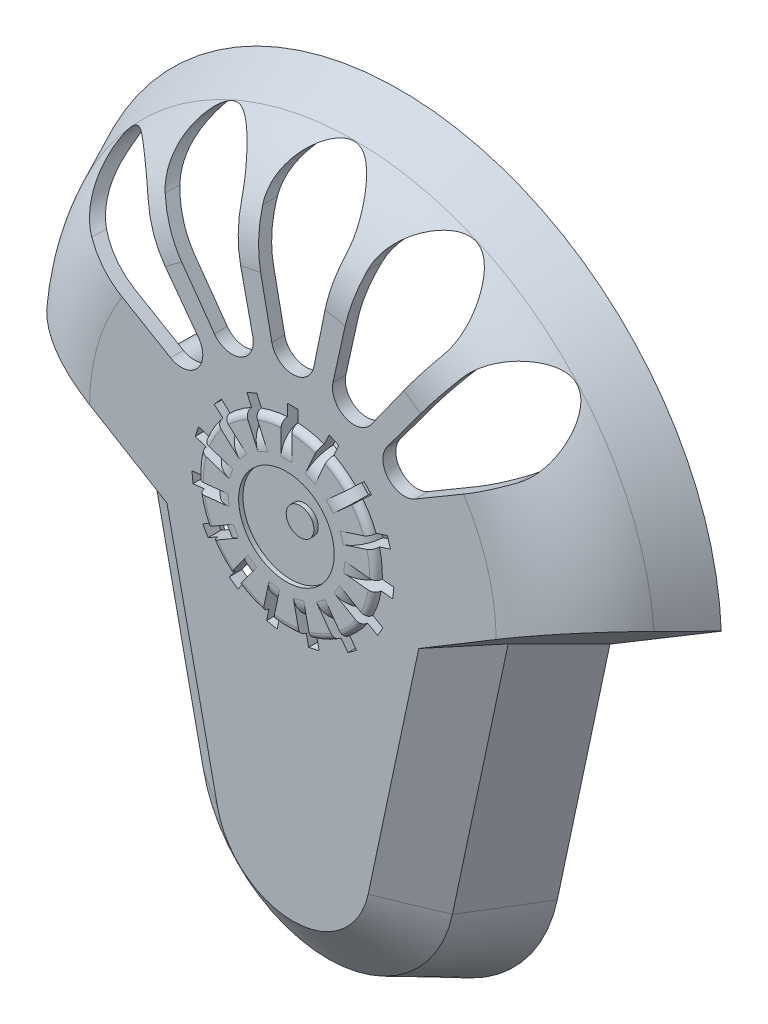
from build123d import *
from OCP.BRepFilletAPI import BRepFilletAPI_MakeChamfer

# Parameters (mm, degrees)
BOSS_EXTRUDE1_DEPTH           = 12.7
BOSS_EXTRUDE1_DRAFT           = 25
CHAMFER1_SIZE                 = 4.5974
CHAMFER1_SIZE2                = 4.007661149
FILLET1_R                     = 12.7
SHELL1_T                      = -1.524
CUT_EXTRUDE2_DEPTH            = 62.981023079
SKETCH3_R                     = 10.6045
BOSS_EXTRUDE2_DEPTH           = 0.762
SKETCH4_W                     = 1.27
SKETCH4_H                     = 2.54
CUT_EXTRUDE3_DEPTH            = 63.141633919
FILLET2_R                     = 2.54
FILLET4_R                     = 0.762
CIRPATTERN1_START             = 0.814632671
CIRPATTERN1_DEPTH             = 1.27
CIRPATTERN1_START_2           = -2.084632671
CIRPATTERN1_2_DEPTH           = 1.27
CIRPATTERN1_START_3           = -3.283610683
CIRPATTERN1_3_DEPTH           = 1.27
CIRPATTERN1_START_4           = -4.024619847
CIRPATTERN1_4_DEPTH           = 1.27
CIRPATTERN1_START_5           = 2.909532945
CIRPATTERN1_5_DEPTH           = 1.27
CIRPATTERN1_START_6           = 2.451564096
CIRPATTERN1_6_DEPTH           = 1.27
CIRPATTERN1_START_7           = 1.459900274
CIRPATTERN1_7_DEPTH           = 1.27
CIRPATTERN1_START_8           = 0.106009163
CIRPATTERN1_8_DEPTH           = 1.27
CIRPATTERN1_START_9           = -1.376009163
CIRPATTERN1_9_DEPTH           = 1.27
CIRPATTERN1_START_10          = -2.729900274
CIRPATTERN1_10_DEPTH          = 1.27
CIRPATTERN1_START_11          = -3.721564096
CIRPATTERN1_11_DEPTH          = 1.27
CIRPATTERN1_START_12          = -4.179532945
CIRPATTERN1_12_DEPTH          = 1.27
CIRPATTERN1_START_13          = 2.754619847
CIRPATTERN1_13_DEPTH          = 1.27
CIRPATTERN1_START_14          = 2.013610683
CIRPATTERN1_14_DEPTH          = 1.27
SKETCH5_R                     = 5.663799449
SKETCH5_R_2                   = 1.641486717
CUT_EXTRUDE4_DEPTH            = 0.508
SKETCH6_R                     = 2.2225
BOSS_EXTRUDE4_DEPTH           = 9.525
BOSS_EXTRUDE4_DRAFT           = -1
BOSS_EXTRUDE4_PROFILE_2_DEPTH = 9.525
BOSS_EXTRUDE4_PROFILE_2_DRAFT = -1
BOSS_EXTRUDE4_PROFILE_3_DEPTH = 9.525
BOSS_EXTRUDE4_PROFILE_3_DRAFT = -1
SKETCH9_R                     = 1.27
CUT_EXTRUDE5_DEPTH            = 2.54
CUT_EXTRUDE5_DRAFT            = -1
CUT_EXTRUDE5_PROFILE_2_DEPTH  = 2.54
CUT_EXTRUDE5_PROFILE_2_DRAFT  = -1
CUT_EXTRUDE5_PROFILE_3_DEPTH  = 2.54
CUT_EXTRUDE5_PROFILE_3_DRAFT  = -1
SKETCH10_R                    = 7.62
SKETCH10_R_2                  = 6.35
BOSS_EXTRUDE5_DEPTH           = 3.302


# Read off the part's stored shape, not the designer's step: CirPattern1
# Some blends are built 0.0001 mm under size
with BuildPart() as part:
    # Sketch1 → Boss-Extrude1 (with draft: the straight prism first)
    with BuildSketch(Plane.XY):
        with BuildLine():
            Line((-24.874524999, -2.785942777), (-18.633711794, -32.146660487))
            ThreePointArc((-18.633711794, -32.146660487), (0, -47.235942777), (18.633711794, -32.146660487))
            Line((18.633711794, -32.146660487), (24.874524999, -2.785942777))
            Line((24.874524999, -2.785942777), (38.067347186, 5.14110453))
            ThreePointArc((38.067347186, 5.14110453), (0, 41.664057223), (-38.067347186, 5.14110453))
            Line((-38.067347186, 5.14110453), (-24.874524999, -2.785942777))
        make_face()
    extrude(amount=BOSS_EXTRUDE1_DEPTH)
    # Boss-Extrude1: the draft: its side faces are tilted about the plane it starts from
    boss_extrude1_sides = [part.faces().sort_by_distance(p)[0] for p in [
        (-31.470936092, 1.177580877, 6.35),
        (-21.754118396, -17.466301632, 6.35),
        (0, -47.235942777, 6.35),
        (21.754118396, -17.466301632, 6.35),
        (31.470936092, 1.177580877, 6.35),
        (0, 41.664057223, 6.35),
    ]]
    draft(boss_extrude1_sides, Plane.XY, BOSS_EXTRUDE1_DRAFT)

    # Chamfer1: one chamfer whose edges measure the first distance from different faces: ONE call of the kernel's chamfer builder (chamfer() names one face for all edges)
    chamfer1_edges_1 = [part.edges().sort_by_distance(p)[0] for p in [
        (0, -41.313835518, 12.7),
    ]]
    chamfer1_side_1 = [part.faces().sort_by_distance(p)[0] for p in [
        (0, -44.274889147, 6.35),
    ]]
    chamfer1_edges_2 = [part.edges().sort_by_distance(p)[0] for p in [
        (16.229110266, -14.975658562, 12.7),
    ]]
    chamfer1_side_2 = [part.faces().sort_by_distance(p)[0] for p in [
        (18.953741494, -16.203907232, 6.437055985),
    ]]
    chamfer1_edges_3 = [part.edges().sort_by_distance(p)[0] for p in [
        (-16.229110266, -14.975658562, 12.7),
    ]]
    chamfer1_side_3 = [part.faces().sort_by_distance(p)[0] for p in [
        (-18.953741494, -16.203907232, 6.437055985),
    ]]
    chamfer1 = BRepFilletAPI_MakeChamfer(part.part.solid().wrapped)
    for e in chamfer1_edges_1:
        chamfer1.Add(CHAMFER1_SIZE, CHAMFER1_SIZE2, e.wrapped, chamfer1_side_1[0].wrapped)  # the first distance lies on this face
    for e in chamfer1_edges_2:
        chamfer1.Add(CHAMFER1_SIZE, CHAMFER1_SIZE2, e.wrapped, chamfer1_side_2[0].wrapped)  # the first distance lies on this face
    for e in chamfer1_edges_3:
        chamfer1.Add(CHAMFER1_SIZE, CHAMFER1_SIZE2, e.wrapped, chamfer1_side_3[0].wrapped)  # the first distance lies on this face
    add(Compound.cast(chamfer1.Shape()), mode=Mode.REPLACE)

    # Fillet1
    fillet1_edges = [part.edges().sort_by_distance(p)[0] for p in [
        (0, 35.741949965, 12.7),
    ]]
    fillet(fillet1_edges, radius=FILLET1_R)

    # Shell1
    shell1_openings = [part.faces().sort_by_distance(p)[0] for p in [
        (0, 1.750652069, 0),
    ]]
    offset(amount=SHELL1_T, openings=shell1_openings, kind=Kind.INTERSECTION)

    # Sketch2 → Cut-Extrude2 (cut, through all)
    with BuildSketch(Plane.XY.offset(12.7)):
        with BuildLine():
            Line((9.298679051, 18.330576377), (16.531135955, 28.456284605))
            ThreePointArc((16.531135955, 28.456284605), (14.463555028, 36.049733697), (7.437040948, 32.505236569))
            Line((7.437040948, 32.505236569), (4.751631547, 20.355052359))
            ThreePointArc((4.751631547, 20.355052359), (6.19866644, 17.486489998), (9.298679051, 18.330576377))
        make_face()
        with BuildLine():
            Line((2.488681579, 20.836057223), (4.977363157, 33.028057223))
            ThreePointArc((4.977363157, 33.028057223), (0, 39.124057223), (-4.977363157, 33.028057223))
            Line((-4.977363157, 33.028057223), (-2.488681579, 20.836057223))
            ThreePointArc((-2.488681579, 20.836057223), (0, 18.804057223), (2.488681579, 20.836057223))
        make_face()
        with BuildLine():
            Line((14.500850439, 13.271830219), (25.226525165, 19.580419734))
            ThreePointArc((25.226525165, 19.580419734), (26.426229994, 27.358341586), (18.56551311, 26.978223084))
            Line((18.56551311, 26.978223084), (11.170344412, 16.970731894))
            ThreePointArc((11.170344412, 16.970731894), (11.32552714, 13.761607664), (14.500850439, 13.271830219))
        make_face()
    cut_extrude2 = extrude(amount=-CUT_EXTRUDE2_DEPTH, mode=Mode.SUBTRACT)

    # Mirror1: Cut-Extrude2 across plane
    add(cut_extrude2.mirror(Plane(origin=(0, 0, 0), x_dir=(0, 0, 1), z_dir=(1, 0, 0))), mode=Mode.SUBTRACT)

    # Sketch3 → Boss-Extrude2 (add)
    with BuildSketch(Plane.XY.offset(12.7)):
        with Locations(Location((0, 3.564057223, 0), (0, 0, 180))):
            Circle(SKETCH3_R)
    extrude(amount=BOSS_EXTRUDE2_DEPTH)

    # Sketch4 → Cut-Extrude3 (cut, through all)
    with BuildSketch(Plane.XY.offset(13.462)):
        with Locations((0, 14.257457223)):
            Rectangle(SKETCH4_W, SKETCH4_H)
    extrude(amount=-CUT_EXTRUDE3_DEPTH, mode=Mode.SUBTRACT)

    # Fillet2
    # the kernel refuses this fillet: 2.54 mm, written as the material it takes off along each edge
    with BuildSketch(Plane(origin=(-0.635, 12.987457223, 13.462), x_dir=(0, 0, -1), z_dir=(1, 0, 0))) as fillet2_piece_1:
        with BuildLine():
            CenterArc((2.54, -2.52726809), FILLET2_R, 95.739170477, 84.260829523)
            Line((0, -2.52726809), (-0.0508, -2.52726809))
            Line((-0.0508, -2.52726809), (-0.0508, 0))
            Line((-0.0508, 0), (0, 0.0508))
            ThreePointArc((0, 0.0508), (1.143, 0.0508), (2.28092, 0.050545362))
            Line((2.28092, 0.050545362), (2.286, 0))
        make_face()
    extrude(amount=1.27, mode=Mode.SUBTRACT)

    # Fillet4
    fillet4_edges = [part.edges().sort_by_distance(p)[0] for p in [
        (0, -7.040442777, 13.462),
    ]]
    fillet(fillet4_edges, radius=FILLET4_R - 0.0001)  # a hair under: the kernel refuses the full size

    # CirPattern1 outline → CirPattern1 (cut)
    with BuildSketch(Plane(origin=(0, 0, 0), x_dir=(-0.4067366430758008, 0.9135454576426006, 0), z_dir=(0.9135454576426006, 0.4067366430758008, 0)).offset(CIRPATTERN1_START)):
        with BuildLine():
            Line((15.219328287, 10), (15.219328287, 13.462))
            Line((15.219328287, 13.462), (10.152060197, 13.462))
            ThreePointArc((10.152060197, 13.462), (11.855943996, 12.805714416), (12.679328287, 11.176))
            Line((12.679328287, 11.176), (12.797520734, 10))
            Line((12.797520734, 10), (15.219328287, 10))
        make_face()
    extrude(amount=CIRPATTERN1_DEPTH, mode=Mode.SUBTRACT)

    # CirPattern1 2 outline → CirPattern1 2 (cut)
    with BuildSketch(Plane(origin=(0, 0, 0), x_dir=(0.40673664307578905, 0.9135454576426059, 0), z_dir=(0.913545457642606, -0.406736643075789, 0)).offset(CIRPATTERN1_START_2)):
        with BuildLine():
            Line((15.219328287, 10), (15.219328287, 13.462))
            Line((15.219328287, 13.462), (10.152060197, 13.462))
            ThreePointArc((10.152060197, 13.462), (11.855943996, 12.805714416), (12.679328287, 11.176))
            Line((12.679328287, 11.176), (12.797520734, 10))
            Line((12.797520734, 10), (15.219328287, 10))
        make_face()
    extrude(amount=CIRPATTERN1_2_DEPTH, mode=Mode.SUBTRACT)

    # CirPattern1 3 outline → CirPattern1 3 (cut)
    with BuildSketch(Plane(origin=(0, 0, 0), x_dir=(0.743144825477386, 0.6691306063588673, 0), z_dir=(0.6691306063588672, -0.7431448254773863, 0)).offset(CIRPATTERN1_START_3)):
        with BuildLine():
            Line((14.348219771, 10), (14.348219771, 13.462))
            Line((14.348219771, 13.462), (9.280951681, 13.462))
            ThreePointArc((9.280951681, 13.462), (10.98483548, 12.805714416), (11.808219771, 11.176))
            Line((11.808219771, 11.176), (11.926412218, 10))
            Line((11.926412218, 10), (14.348219771, 10))
        make_face()
    extrude(amount=CIRPATTERN1_3_DEPTH, mode=Mode.SUBTRACT)

    # CirPattern1 4 outline → CirPattern1 4 (cut)
    with BuildSketch(Plane(origin=(0, 0, 0), x_dir=(0.9510565162951504, 0.3090169943749572, 0), z_dir=(0.30901699437495717, -0.9510565162951505, 0)).offset(CIRPATTERN1_START_4)):
        with BuildLine():
            Line((13.064754251, 10), (13.064754251, 13.462))
            Line((13.064754251, 13.462), (7.997486161, 13.462))
            ThreePointArc((7.997486161, 13.462), (9.70136996, 12.805714416), (10.524754251, 11.176))
            Line((10.524754251, 11.176), (10.642946698, 10))
            Line((10.642946698, 10), (13.064754251, 10))
        make_face()
    extrude(amount=CIRPATTERN1_4_DEPTH, mode=Mode.SUBTRACT)

    # CirPattern1 5 outline → CirPattern1 5 (cut)
    with BuildSketch(Plane(origin=(0, 0, 0), x_dir=(0.9945218953682743, -0.10452846326764395, 0), z_dir=(0.10452846326764395, 0.9945218953682744, 0)).offset(CIRPATTERN1_START_5)):
        with BuildLine():
            Line((11.590854575, -13.462), (11.590854575, -10))
            Line((11.590854575, -10), (9.169047022, -10))
            Line((9.169047022, -10), (9.050854575, -11.176))
            ThreePointArc((9.050854575, -11.176), (8.227470284, -12.805714416), (6.523586485, -13.462))
            Line((6.523586485, -13.462), (11.590854575, -13.462))
        make_face()
    extrude(amount=CIRPATTERN1_5_DEPTH, mode=Mode.SUBTRACT)

    # CirPattern1 6 outline → CirPattern1 6 (cut)
    with BuildSketch(Plane(origin=(0, 0, 0), x_dir=(0.8660254037844431, -0.4999999999999921, 0), z_dir=(0.4999999999999921, 0.8660254037844433, 0)).offset(CIRPATTERN1_START_6)):
        with BuildLine():
            Line((10.181371388, -13.462), (10.181371388, -10))
            Line((10.181371388, -10), (7.759563835, -10))
            Line((7.759563835, -10), (7.641371388, -11.176))
            ThreePointArc((7.641371388, -11.176), (6.817987097, -12.805714416), (5.114103298, -13.462))
            Line((5.114103298, -13.462), (10.181371388, -13.462))
        make_face()
    extrude(amount=CIRPATTERN1_6_DEPTH, mode=Mode.SUBTRACT)

    # CirPattern1 7 outline → CirPattern1 7 (cut)
    with BuildSketch(Plane(origin=(0, 0, 0), x_dir=(0.5877852522924796, -0.8090169943749428, 0), z_dir=(0.8090169943749427, 0.5877852522924798, 0)).offset(CIRPATTERN1_START_7)):
        with BuildLine():
            Line((9.080017137, -13.462), (9.080017137, -10))
            Line((9.080017137, -10), (6.658209584, -10))
            Line((6.658209584, -10), (6.540017137, -11.176))
            ThreePointArc((6.540017137, -11.176), (5.716632846, -12.805714416), (4.012749047, -13.462))
            Line((4.012749047, -13.462), (9.080017137, -13.462))
        make_face()
    extrude(amount=CIRPATTERN1_7_DEPTH, mode=Mode.SUBTRACT)

    # CirPattern1 8 outline → CirPattern1 8 (cut)
    with BuildSketch(Plane(origin=(0, 0, 0), x_dir=(-0.20791169081776606, 0.9781476007338042, 0), z_dir=(0.9781476007338042, 0.20791169081776606, 0)).offset(CIRPATTERN1_START_8)):
        with BuildLine():
            Line((-8.477225978, 13.462), (-8.477225978, 10))
            Line((-8.477225978, 10), (-6.055418425, 10))
            Line((-6.055418425, 10), (-5.937225978, 11.176))
            ThreePointArc((-5.937225978, 11.176), (-5.113841687, 12.805714416), (-3.409957888, 13.462))
            Line((-3.409957888, 13.462), (-8.477225978, 13.462))
        make_face()
    extrude(amount=CIRPATTERN1_8_DEPTH, mode=Mode.SUBTRACT)

    # CirPattern1 9 outline → CirPattern1 9 (cut)
    with BuildSketch(Plane(origin=(0, 0, 0), x_dir=(0.20791169081775301, 0.978147600733807, 0), z_dir=(0.978147600733807, -0.207911690817753, 0)).offset(CIRPATTERN1_START_9)):
        with BuildLine():
            Line((-8.477225978, 13.462), (-8.477225978, 10))
            Line((-8.477225978, 10), (-6.055418425, 10))
            Line((-6.055418425, 10), (-5.937225978, 11.176))
            ThreePointArc((-5.937225978, 11.176), (-5.113841687, 12.805714416), (-3.409957888, 13.462))
            Line((-3.409957888, 13.462), (-8.477225978, 13.462))
        make_face()
    extrude(amount=CIRPATTERN1_9_DEPTH, mode=Mode.SUBTRACT)

    # CirPattern1 10 outline → CirPattern1 10 (cut)
    with BuildSketch(Plane(origin=(0, 0, 0), x_dir=(0.5877852522924693, 0.8090169943749502, 0), z_dir=(0.8090169943749502, -0.5877852522924693, 0)).offset(CIRPATTERN1_START_10)):
        with BuildLine():
            Line((-9.080017137, 13.462), (-9.080017137, 10))
            Line((-9.080017137, 10), (-6.658209584, 10))
            Line((-6.658209584, 10), (-6.540017137, 11.176))
            ThreePointArc((-6.540017137, 11.176), (-5.716632846, 12.805714416), (-4.012749047, 13.462))
            Line((-4.012749047, 13.462), (-9.080017137, 13.462))
        make_face()
    extrude(amount=CIRPATTERN1_10_DEPTH, mode=Mode.SUBTRACT)

    # CirPattern1 11 outline → CirPattern1 11 (cut)
    with BuildSketch(Plane(origin=(0, 0, 0), x_dir=(0.8660254037844362, 0.5000000000000042, 0), z_dir=(0.5000000000000042, -0.8660254037844363, 0)).offset(CIRPATTERN1_START_11)):
        with BuildLine():
            Line((-10.181371388, 13.462), (-10.181371388, 10))
            Line((-10.181371388, 10), (-7.759563835, 10))
            Line((-7.759563835, 10), (-7.641371388, 11.176))
            ThreePointArc((-7.641371388, 11.176), (-6.817987097, 12.805714416), (-5.114103298, 13.462))
            Line((-5.114103298, 13.462), (-10.181371388, 13.462))
        make_face()
    extrude(amount=CIRPATTERN1_11_DEPTH, mode=Mode.SUBTRACT)

    # CirPattern1 12 outline → CirPattern1 12 (cut)
    with BuildSketch(Plane(origin=(0, 0, 0), x_dir=(0.994521895368273, 0.104528463267657, 0), z_dir=(0.104528463267657, -0.994521895368273, 0)).offset(CIRPATTERN1_START_12)):
        with BuildLine():
            Line((-11.590854575, 13.462), (-11.590854575, 10))
            Line((-11.590854575, 10), (-9.169047022, 10))
            Line((-9.169047022, 10), (-9.050854575, 11.176))
            ThreePointArc((-9.050854575, 11.176), (-8.227470284, 12.805714416), (-6.523586485, 13.462))
            Line((-6.523586485, 13.462), (-11.590854575, 13.462))
        make_face()
    extrude(amount=CIRPATTERN1_12_DEPTH, mode=Mode.SUBTRACT)

    # CirPattern1 13 outline → CirPattern1 13 (cut)
    with BuildSketch(Plane(origin=(0, 0, 0), x_dir=(0.9510565162951542, -0.30901699437494523, 0), z_dir=(0.3090169943749452, 0.9510565162951544, 0)).offset(CIRPATTERN1_START_13)):
        with BuildLine():
            Line((-13.064754251, -10), (-13.064754251, -13.462))
            Line((-13.064754251, -13.462), (-7.997486161, -13.462))
            ThreePointArc((-7.997486161, -13.462), (-9.70136996, -12.805714416), (-10.524754251, -11.176))
            Line((-10.524754251, -11.176), (-10.642946698, -10))
            Line((-10.642946698, -10), (-13.064754251, -10))
        make_face()
    extrude(amount=CIRPATTERN1_13_DEPTH, mode=Mode.SUBTRACT)

    # CirPattern1 14 outline → CirPattern1 14 (cut)
    with BuildSketch(Plane(origin=(0, 0, 0), x_dir=(0.743144825477395, -0.6691306063588573, 0), z_dir=(0.6691306063588572, 0.7431448254773952, 0)).offset(CIRPATTERN1_START_14)):
        with BuildLine():
            Line((-14.348219771, -10), (-14.348219771, -13.462))
            Line((-14.348219771, -13.462), (-9.280951681, -13.462))
            ThreePointArc((-9.280951681, -13.462), (-10.98483548, -12.805714416), (-11.808219771, -11.176))
            Line((-11.808219771, -11.176), (-11.926412218, -10))
            Line((-11.926412218, -10), (-14.348219771, -10))
        make_face()
    extrude(amount=CIRPATTERN1_14_DEPTH, mode=Mode.SUBTRACT)

    # Sketch5 → Cut-Extrude4 (cut)
    with BuildSketch(Plane.XY.offset(13.462)):
        with Locations((0, 3.564057223)):
            Circle(SKETCH5_R)
        with Locations((1.615155089, 4.897963805)):
            Circle(SKETCH5_R_2, mode=Mode.SUBTRACT)
    extrude(amount=-CUT_EXTRUDE4_DEPTH, mode=Mode.SUBTRACT)


with BuildPart() as boss_extrude4_tool:
    # Sketch6 → Boss-Extrude4 (with draft: the straight prism first)
    with BuildSketch(Plane.XY.offset(12.7)):
        with Locations((0, -28.185942777)):
            Circle(SKETCH6_R)
    extrude(amount=-BOSS_EXTRUDE4_DEPTH)
    # Boss-Extrude4: the draft: its side faces are tilted about the plane it starts from
    boss_extrude4_sides = [boss_extrude4_tool.faces().sort_by_distance(p)[0] for p in [
        (-2.2225, -28.185942777, 7.9375),
    ]]
    draft(boss_extrude4_sides, Plane.XY.offset(12.7), BOSS_EXTRUDE4_DRAFT)


with BuildPart() as part_1:
    add(part.part)

    # Boss-Extrude4: add boss_extrude4_tool
    add(boss_extrude4_tool.part)


with BuildPart() as boss_extrude4_profile_2_tool:
    # Sketch6 → Boss-Extrude4 profile 2 (with draft: the straight prism first)
    with BuildSketch(Plane.XY.offset(12.7)):
        with Locations((-19.05, 6.739057223)):
            Circle(SKETCH6_R)
    extrude(amount=-BOSS_EXTRUDE4_PROFILE_2_DEPTH)
    # Boss-Extrude4 profile 2: the draft: its side faces are tilted about the plane it starts from
    boss_extrude4_profile_2_sides = [boss_extrude4_profile_2_tool.faces().sort_by_distance(p)[0] for p in [
        (-21.2725, 6.739057223, 7.9375),
    ]]
    draft(boss_extrude4_profile_2_sides, Plane.XY.offset(12.7), BOSS_EXTRUDE4_PROFILE_2_DRAFT)


with BuildPart() as part_2:
    add(part_1.part)

    # Boss-Extrude4 profile 2: add boss_extrude4_profile_2_tool
    add(boss_extrude4_profile_2_tool.part)


with BuildPart() as boss_extrude4_profile_3_tool:
    # Sketch6 → Boss-Extrude4 profile 3 (with draft: the straight prism first)
    with BuildSketch(Plane.XY.offset(12.7)):
        with Locations((19.05, 6.739057223)):
            Circle(SKETCH6_R)
    extrude(amount=-BOSS_EXTRUDE4_PROFILE_3_DEPTH)
    # Boss-Extrude4 profile 3: the draft: its side faces are tilted about the plane it starts from
    boss_extrude4_profile_3_sides = [boss_extrude4_profile_3_tool.faces().sort_by_distance(p)[0] for p in [
        (16.8275, 6.739057223, 7.9375),
    ]]
    draft(boss_extrude4_profile_3_sides, Plane.XY.offset(12.7), BOSS_EXTRUDE4_PROFILE_3_DRAFT)


with BuildPart() as part_3:
    add(part_2.part)

    # Boss-Extrude4 profile 3: add boss_extrude4_profile_3_tool
    add(boss_extrude4_profile_3_tool.part)


with BuildPart() as cut_extrude5_tool:
    # Sketch9 → Cut-Extrude5 (with draft: the straight prism first)
    with BuildSketch(Plane(origin=(0, 0, 3.175), x_dir=(-1, 0, 0), z_dir=(0, 0, -1))):
        with Locations((-19.05, 6.739057223)):
            Circle(SKETCH9_R)
    extrude(amount=-CUT_EXTRUDE5_DEPTH)
    # Cut-Extrude5: the draft: its side faces are tilted about the plane it starts from
    cut_extrude5_sides = [cut_extrude5_tool.faces().sort_by_distance(p)[0] for p in [
        (20.32, 6.739057223, 4.445),
    ]]
    draft(cut_extrude5_sides, Plane(origin=(0, 0, 3.175), x_dir=(-1, 0, 0), z_dir=(0, 0, -1)), CUT_EXTRUDE5_DRAFT)


with BuildPart() as part_4:
    add(part_3.part)

    # Cut-Extrude5: cut by cut_extrude5_tool
    add(cut_extrude5_tool.part, mode=Mode.SUBTRACT)


with BuildPart() as cut_extrude5_profile_2_tool:
    # Sketch9 → Cut-Extrude5 profile 2 (with draft: the straight prism first)
    with BuildSketch(Plane(origin=(0, 0, 3.175), x_dir=(-1, 0, 0), z_dir=(0, 0, -1))):
        with Locations((19.05, 6.739057223)):
            Circle(SKETCH9_R)
    extrude(amount=-CUT_EXTRUDE5_PROFILE_2_DEPTH)
    # Cut-Extrude5 profile 2: the draft: its side faces are tilted about the plane it starts from
    cut_extrude5_profile_2_sides = [cut_extrude5_profile_2_tool.faces().sort_by_distance(p)[0] for p in [
        (-17.78, 6.739057223, 4.445),
    ]]
    draft(cut_extrude5_profile_2_sides, Plane(origin=(0, 0, 3.175), x_dir=(-1, 0, 0), z_dir=(0, 0, -1)), CUT_EXTRUDE5_PROFILE_2_DRAFT)


with BuildPart() as part_5:
    add(part_4.part)

    # Cut-Extrude5 profile 2: cut by cut_extrude5_profile_2_tool
    add(cut_extrude5_profile_2_tool.part, mode=Mode.SUBTRACT)


with BuildPart() as cut_extrude5_profile_3_tool:
    # Sketch9 → Cut-Extrude5 profile 3 (with draft: the straight prism first)
    with BuildSketch(Plane(origin=(0, 0, 3.175), x_dir=(-1, 0, 0), z_dir=(0, 0, -1))):
        with Locations((0, -28.185942777)):
            Circle(SKETCH9_R)
    extrude(amount=-CUT_EXTRUDE5_PROFILE_3_DEPTH)
    # Cut-Extrude5 profile 3: the draft: its side faces are tilted about the plane it starts from
    cut_extrude5_profile_3_sides = [cut_extrude5_profile_3_tool.faces().sort_by_distance(p)[0] for p in [
        (1.27, -28.185942777, 4.445),
    ]]
    draft(cut_extrude5_profile_3_sides, Plane(origin=(0, 0, 3.175), x_dir=(-1, 0, 0), z_dir=(0, 0, -1)), CUT_EXTRUDE5_PROFILE_3_DRAFT)


with BuildPart() as part_6:
    add(part_5.part)

    # Cut-Extrude5 profile 3: cut by cut_extrude5_profile_3_tool
    add(cut_extrude5_profile_3_tool.part, mode=Mode.SUBTRACT)

    # Sketch10 → Boss-Extrude5 (add)
    with BuildSketch(Plane(origin=(0, 0, 11.176), x_dir=(-1, 0, 0), z_dir=(0, 0, -1))):
        with Locations(Location((0, 3.564057223, 0), (0, 0, 180))):
            Circle(SKETCH10_R)
        with Locations(Location((0, 3.564057223, 0), (0, 0, 180))):
            Circle(SKETCH10_R_2, mode=Mode.SUBTRACT)
    extrude(amount=BOSS_EXTRUDE5_DEPTH)


solid = part_6.part
